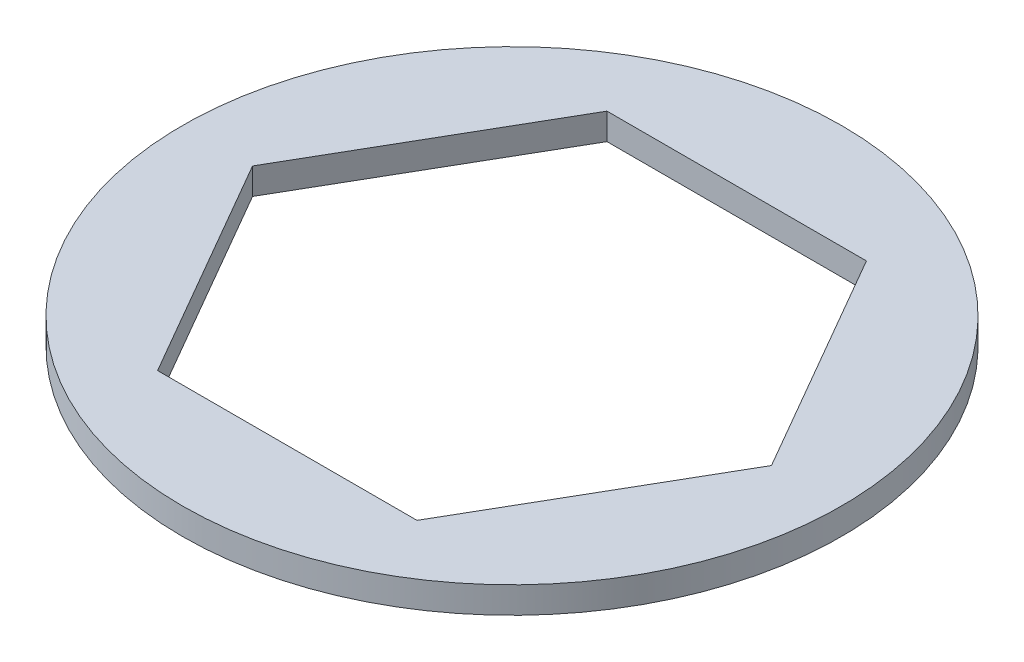
from build123d import *

# Parameters (mm, degrees)
SKETCH1_R           = 9.5
BOSS_EXTRUDE1_DEPTH = 0.762


with BuildPart() as part:
    # Sketch1 → Boss-Extrude1 (new body)
    with BuildSketch(Plane(origin=(0, 0, 0), x_dir=(1, 0, 0), z_dir=(0, 1, 0))):
        Circle(SKETCH1_R)
        Polygon((7.478995387, 0), (3.739497694, 6.477), (-3.739497694, 6.477), (-7.478995387, 0), (-3.739497694, -6.477), (3.739497694, -6.477), align=None, mode=Mode.SUBTRACT)
    extrude(amount=-BOSS_EXTRUDE1_DEPTH)


solid = part.part
